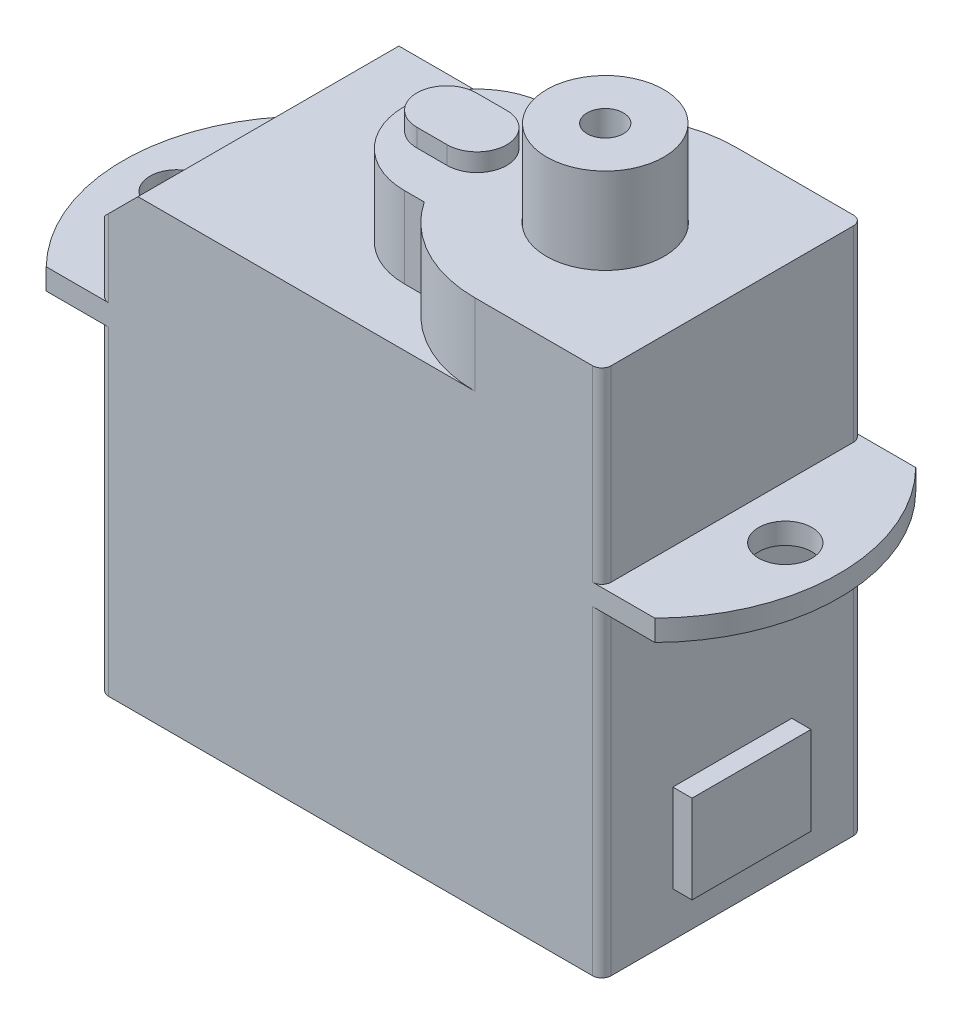
from build123d import *

# Parameters (mm, degrees)
SKETCH_1_W          = 16.22
SKETCH_1_H          = 8.42
EXTRUDE_1_DEPTH     = 11
SKETCH_2_R          = 0.86
EXTRUDE_2_DEPTH     = 0.68
SKETCH_3_W          = 16.22
SKETCH_3_H          = 8.42
EXTRUDE_3_DEPTH     = 3.44
SKETCH_4_R          = 1.9
EXTRUDE_4_DEPTH     = 2.61
EXTRUDE_5_DEPTH     = 0.58
SKETCH_6_R          = 1.89
EXTRUDE_6_DEPTH     = 5.38
SKETCH_7_R          = 0.585
CUT_EXTRUDE_1_DEPTH = 3.6
CHAMFER_1_SIZE      = 1.25
FILLET_1_R          = 0.3
SKETCH_8_W          = 3.84
SKETCH_8_H          = 2.845310476
EXTRUDE_7_DEPTH     = 0.62


with BuildPart() as part:
    # 草图1 → 凸台-拉伸1 (new body)
    with BuildSketch(Plane(origin=(0, 0, 0), x_dir=(1, 0, 0), z_dir=(0, 1, 0))):
        Rectangle(SKETCH_1_W, SKETCH_1_H)
    extrude(amount=EXTRUDE_1_DEPTH)

    # 草图2 → 凸台-拉伸2 (add)
    # profile 1 of 2: a face of its own
    with BuildSketch(Plane(origin=(0, 11, 0), x_dir=(1, 0, 0), z_dir=(0, 1, 0))):
        with BuildLine():
            Line((-8.11, -4.21), (-8.11, 4.21))
            Line((-8.11, 4.21), (-9.82, 4.21))
            ThreePointArc((-9.82, 4.21), (-11.55, 0), (-9.82, -4.21))
            Line((-9.82, -4.21), (-8.11, -4.21))
        make_face()
        with Locations((-9.82, 0)):
            Circle(SKETCH_2_R, mode=Mode.SUBTRACT)
    # profile 2 of 2: a face of its own
    with BuildSketch(Plane(origin=(0, 11, 0), x_dir=(1, 0, 0), z_dir=(0, 1, 0))):
        with BuildLine():
            Line((9.82, 4.21), (8.11, 4.21))
            Line((8.11, 4.21), (8.11, -4.21))
            Line((8.11, -4.21), (9.82, -4.21))
            ThreePointArc((9.82, -4.21), (11.55, 0), (9.82, 4.21))
        make_face()
        with Locations((9.82, 0)):
            Circle(SKETCH_2_R, mode=Mode.SUBTRACT)
    extrude(amount=-EXTRUDE_2_DEPTH)

    # 草图3 → 凸台-拉伸3 (add)
    with BuildSketch(Plane(origin=(0, 11, 0), x_dir=(1, 0, 0), z_dir=(0, 1, 0))):
        Rectangle(SKETCH_3_W, SKETCH_3_H)
    extrude(amount=EXTRUDE_3_DEPTH)

    # 草图4 → 凸台-拉伸4 (add)
    with BuildSketch(Plane(origin=(0, 14.44, 0), x_dir=(1, 0, 0), z_dir=(0, 1, 0))):
        with BuildLine():
            Line((8.11, -4.21), (8.11, 4.21))
            Line((8.11, 4.21), (4.01, 4.21))
            ThreePointArc((4.01, 4.21), (2.031288298, 3.716019376), (0.516921129, 2.35))
            Line((0.516921129, 2.35), (-0.12, 2.35))
            ThreePointArc((-0.12, 2.35), (-2.47, 0), (-0.12, -2.35))
            Line((-0.12, -2.35), (0.516921129, -2.35))
            ThreePointArc((0.516921129, -2.35), (2.031288298, -3.716019376), (4.01, -4.21))
            Line((4.01, -4.21), (8.11, -4.21))
        make_face()
        with Locations((4.01, 0)):
            Circle(SKETCH_4_R, mode=Mode.SUBTRACT)
    extrude(amount=EXTRUDE_4_DEPTH)

    # 草图5 → 凸台-拉伸5 (add)
    with BuildSketch(Plane(origin=(0, 17.05, 0), x_dir=(1, 0, 0), z_dir=(0, 1, 0))):
        with BuildLine():
            Line((-1.11, 0.96), (-0.13, 0.96))
            ThreePointArc((-0.13, 0.96), (0.83, 0), (-0.13, -0.96))
            Line((-0.13, -0.96), (-1.11, -0.96))
            ThreePointArc((-1.11, -0.96), (-2.07, 0), (-1.11, 0.96))
        make_face()
    extrude(amount=EXTRUDE_5_DEPTH)

    # 草图6 → 凸台-拉伸6 (add)
    with BuildSketch(Plane(origin=(0, 14.44, 0), x_dir=(1, 0, 0), z_dir=(0, 1, 0))):
        with Locations((4.01, 0)):
            Circle(SKETCH_6_R)
    extrude(amount=EXTRUDE_6_DEPTH)

    # 草图7 → 切除-拉伸1 (cut)
    with BuildSketch(Plane(origin=(0, 19.82, 0), x_dir=(1, 0, 0), z_dir=(0, 1, 0))):
        with Locations((4.01, 0)):
            Circle(SKETCH_7_R)
    extrude(amount=-CUT_EXTRUDE_1_DEPTH, mode=Mode.SUBTRACT)

    # Chamfer 1
    chamfer_1_edges = [part.edges().sort_by_distance(p)[0] for p in [
        (-8.11, 14.44, 0),
    ]]
    chamfer(chamfer_1_edges, length=CHAMFER_1_SIZE)

    # Fillet 1
    fillet_1_edges = [part.edges().sort_by_distance(p)[0] for p in [
        (8.11, 5.16, -4.21),
        (8.11, 14.025, -4.21),
        (8.11, 14.025, 4.21),
        (8.11, 5.16, 4.21),
        (-8.11, 12.095, 4.21),
        (-8.11, 12.095, -4.21),
        (-8.11, 5.16, -4.21),
        (-8.11, 5.16, 4.21),
    ]]
    fillet(fillet_1_edges, radius=FILLET_1_R)

    # 草图8 → 凸台-拉伸7 (add)
    with BuildSketch(Plane(origin=(8.11, 0, 0), x_dir=(0, 0, -1), z_dir=(1, 0, 0))):
        with Locations((0, 2.857344762)):
            Rectangle(SKETCH_8_W, SKETCH_8_H)
    extrude(amount=EXTRUDE_7_DEPTH)


solid = part.part
